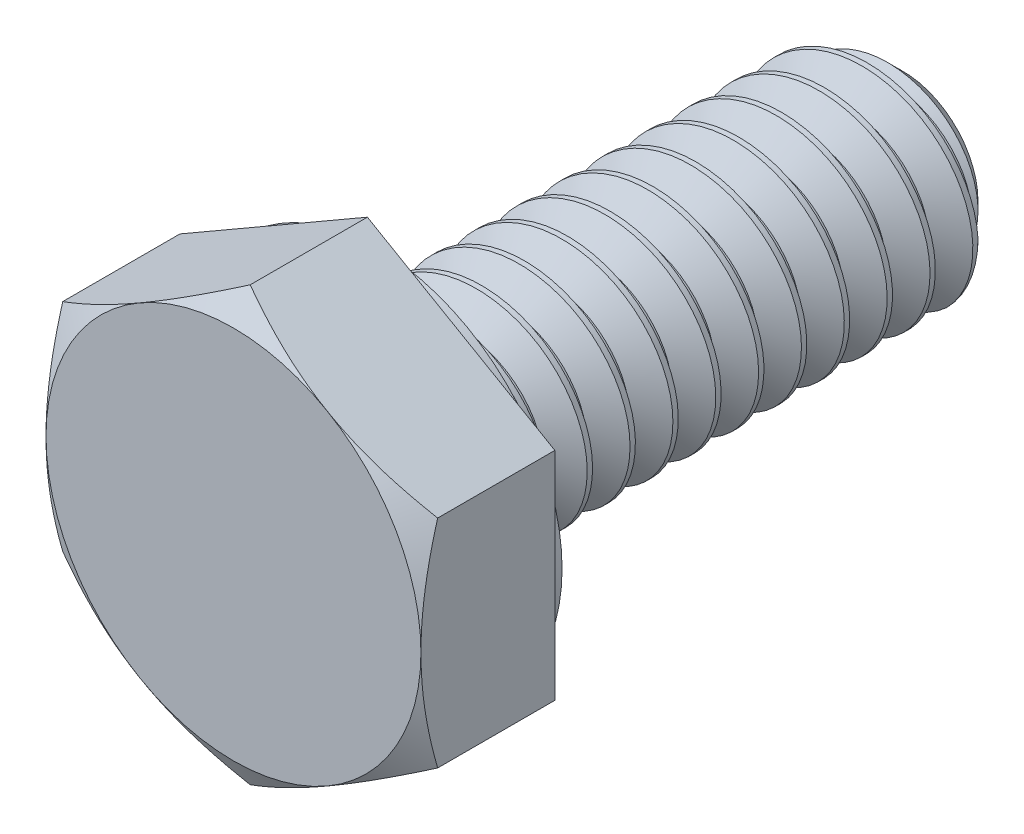
from build123d import *

# Parameters (mm, degrees)
SKETCH2_W           = 15.875
SKETCH2_H           = 3.175
BOSS_EXTRUDE1_DEPTH = 3.96875
SKETCH7_R           = 5.49275
BOSS_EXTRUDE2_DEPTH = 0.2778125
CHAMFER1_SIZE       = 0.9525
SKETCH4_OUTSIDE_W   = 96.564
SKETCH4_OUTSIDE_H   = 98.284
SKETCH4_OUTSIDE_R   = 5.55625
CUT_EXTRUDE1_DEPTH  = 22.582605964
CUT_EXTRUDE1_DRAFT  = -60
CUT_SWEEP1_PITCH    = 1.27
CUT_SWEEP1_TO       = 15.875
BOSS_EXTRUDE3_START = -0.2778125
SKETCH8_R           = 5.49275
BOSS_EXTRUDE3_DEPTH = 0.2778125


with BuildPart() as part:
    # Sketch2 → Revolve1 (revolve)
    with BuildSketch(Plane(origin=(0, 0, 0), x_dir=(0, 0, -1), z_dir=(1, 0, 0)), mode=Mode.PRIVATE) as revolve1_sk:
        with Locations((7.9375, 1.5875)):
            Rectangle(SKETCH2_W, SKETCH2_H)
    revolve(revolve1_sk.sketch.rotate(Axis((0, 0, 0), (0, 0, -1)), 90), axis=Axis((0, 0, 0), (0, 0, -1)))

    # Sketch3 → Boss-Extrude1 (add)
    with BuildSketch(Plane.XY):
        Polygon((0, 6.415804866), (-5.55625, 3.207902433), (-5.55625, -3.207902433), (0, -6.415804866), (5.55625, -3.207902433), (5.55625, 3.207902433), align=None)
    extrude(amount=BOSS_EXTRUDE1_DEPTH)

    # Sketch7 → Boss-Extrude2 (add)
    with BuildSketch(Plane(origin=(0, 0, 0), x_dir=(-1, 0, 0), z_dir=(0, 0, -1))):
        with Locations(Location((0, 0, 0), (0, 0, 180))):
            Circle(SKETCH7_R)
    extrude(amount=BOSS_EXTRUDE2_DEPTH)

    # Chamfer1
    chamfer1_edges = [part.edges().sort_by_distance(p)[0] for p in [
        (-3.175, 0, -15.875),
    ]]
    chamfer(chamfer1_edges, length=CHAMFER1_SIZE)


with BuildPart() as cut_extrude1_tool:
    # Sketch4 outside → Cut-Extrude1 (with draft: the straight prism first)
    with BuildSketch(Plane.XY.offset(3.96875)):
        Rectangle(SKETCH4_OUTSIDE_W, SKETCH4_OUTSIDE_H)
        Circle(SKETCH4_OUTSIDE_R, mode=Mode.SUBTRACT)
    extrude(amount=-CUT_EXTRUDE1_DEPTH)
    # Cut-Extrude1: the draft: its side faces are tilted about the plane it starts from
    cut_extrude1_sides = [cut_extrude1_tool.faces().sort_by_distance(p)[0] for p in [
        (0, -49.142, -7.322552982),
        (48.282, 0, -7.322552982),
        (0, 49.142, -7.322552982),
        (-48.282, 0, -7.322552982),
        (-5.55625, 0, -7.322552982),
    ]]
    draft(cut_extrude1_sides, Plane.XY.offset(3.96875), CUT_EXTRUDE1_DRAFT)


with BuildPart() as part_1:
    add(part.part)

    # Cut-Extrude1: cut by cut_extrude1_tool
    add(cut_extrude1_tool.part, mode=Mode.SUBTRACT)


with BuildPart() as body_2:
    # Split1: read off the stored shape, not the designer's step
    # Split1: the piece on the far side of the plane
    add(part_1.part)
    split(bisect_by=Plane.XY, keep=Keep.BOTTOM)

    # Cut-Sweep1: arcs per turn and ends read off the stored shape
    # Cut-Sweep1: the profile of Sketch5 screwed along a right-hand helix through 13.5 turns, 8 arcs to a turn; built about Z, then put on its axis
    cut_sweep1_z = Axis((0, 0, 0), (0, 0, 1))
    cut_sweep1_corners = [(3.243740766, 0, 0.0396875), (3.243740766, 0, -1.1509375), (2.350110803, 0, -0.635), (2.350110803, 0, -0.47625)]
    with BuildLine(mode=Mode.PRIVATE) as cut_sweep1_profile:
        Line(cut_sweep1_corners[0], cut_sweep1_corners[1])
        Line(cut_sweep1_corners[1], cut_sweep1_corners[2])
        Line(cut_sweep1_corners[2], cut_sweep1_corners[3])
        Line(cut_sweep1_corners[3], cut_sweep1_corners[0])
    cut_sweep1_cap = Face(cut_sweep1_profile.wire())
    cut_sweep1_turn_angles = [0, 22.5, 45, 67.5, 90, 112.5, 135, 157.5, 180, 202.5, 225, 247.5, 270, 292.5, 315, 337.5, 360]
    cut_sweep1_turn_weights = [1, 0.9238795325112867, 1, 0.9238795325112867, 1, 0.9238795325112867, 1, 0.9238795325112867, 1, 0.9238795325112867, 1, 0.9238795325112867, 1, 0.9238795325112867, 1, 0.9238795325112867, 1]
    cut_sweep1_turn_rails = [Edge.make_bspline([Vector(p[0], p[1], 0).rotate(cut_sweep1_z, cut_sweep1_turn_angles[k]) / cut_sweep1_turn_weights[k] + Vector(0, 0, p[2] + CUT_SWEEP1_PITCH * cut_sweep1_turn_angles[k] / 360) for k in range(17)], [0, 0, 0, 1, 1, 2, 2, 3, 3, 4, 4, 5, 5, 6, 6, 7, 7, 8, 8, 8], 2, cut_sweep1_turn_weights) for p in cut_sweep1_corners]
    cut_sweep1_turn_sides = [Face.make_surface_from_curves(cut_sweep1_turn_rails[p[0]], cut_sweep1_turn_rails[p[1]]) for p in [(0, 1), (1, 2), (2, 3), (3, 0)]]
    cut_sweep1_last_angles = [4680, 4702.5, 4725, 4747.5, 4770, 4792.5, 4815, 4837.5, 4860]
    cut_sweep1_last_weights = [1, 0.9238795325112867, 1, 0.9238795325112867, 1, 0.9238795325112867, 1, 0.923879532511223, 1]
    cut_sweep1_last_rails = [Edge.make_bspline([Vector(p[0], p[1], 0).rotate(cut_sweep1_z, cut_sweep1_last_angles[k]) / cut_sweep1_last_weights[k] + Vector(0, 0, p[2] + CUT_SWEEP1_PITCH * cut_sweep1_last_angles[k] / 360) for k in range(9)], [0, 0, 0, 1, 1, 2, 2, 3, 3, 4, 4, 4], 2, cut_sweep1_last_weights) for p in cut_sweep1_corners]
    cut_sweep1_last_sides = [Face.make_surface_from_curves(cut_sweep1_last_rails[p[0]], cut_sweep1_last_rails[p[1]]) for p in [(0, 1), (1, 2), (2, 3), (3, 0)]]
    cut_sweep1 = Plane(origin=(0, 0, -15.875), x_dir=(0, 1, 0), z_dir=(0, 0, 1)) * split(Solid(Shell([*[p.moved(Location((0, 0, CUT_SWEEP1_PITCH * i))) for i in range(13) for p in cut_sweep1_turn_sides], *cut_sweep1_last_sides, cut_sweep1_cap, cut_sweep1_cap.rotate(cut_sweep1_z, 4860).moved(Location((0, 0, CUT_SWEEP1_PITCH * 4860 / 360)))])), bisect_by=Plane.XY.offset(CUT_SWEEP1_TO), keep=Keep.BOTTOM, mode=Mode.PRIVATE)
    add(cut_sweep1, mode=Mode.SUBTRACT)


with BuildPart() as part_2:
    add(part_1.part)

    # Split1
    split(bisect_by=Plane.XY, keep=Keep.TOP)

    # Combine1: union body 2
    add(body_2.part)

    # Sketch8 → Boss-Extrude3 (add)
    with BuildSketch(Plane(origin=(0, 0, -0.2778125), x_dir=(-1, 0, 0), z_dir=(0, 0, -1)).offset(BOSS_EXTRUDE3_START)):
        with Locations(Location((0, 0, 0), (0, 0, 180))):
            Circle(SKETCH8_R)
    extrude(amount=BOSS_EXTRUDE3_DEPTH)


solid = part_2.part
